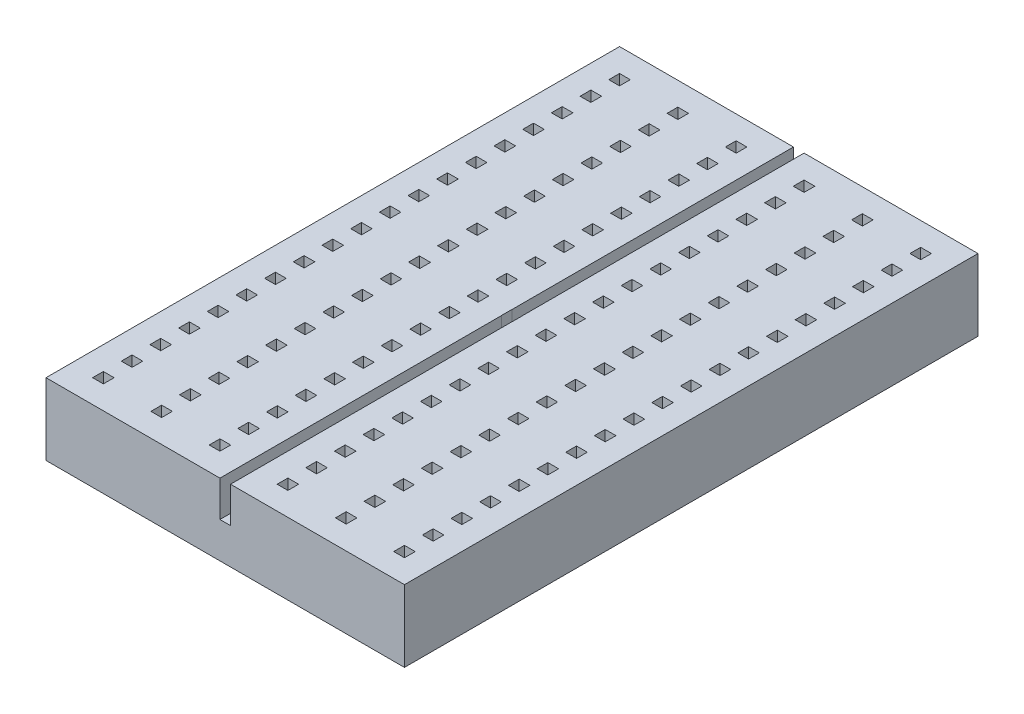
from build123d import *

# Parameters (mm, degrees)
SKETCH1_W           = 50
SKETCH1_H           = 80
BOSS_EXTRUDE1_DEPTH = 10
SKETCH2_W           = 1.477514692
SKETCH2_H           = 80
CUT_EXTRUDE1_DEPTH  = 5
SKETCH4_W           = 1.5
SKETCH4_H           = 1.5
CUT_EXTRUDE2_DEPTH  = 2


with BuildPart() as part:
    # Sketch1 → Boss-Extrude1 (new body)
    with BuildSketch(Plane(origin=(0, 0, 0), x_dir=(1, 0, 0), z_dir=(0, 1, 0))):
        Rectangle(SKETCH1_W, SKETCH1_H)
    extrude(amount=BOSS_EXTRUDE1_DEPTH)

    # Sketch2 → Cut-Extrude1 (cut)
    with BuildSketch(Plane(origin=(0, 10, 0), x_dir=(1, 0, 0), z_dir=(0, 1, 0))):
        Rectangle(SKETCH2_W, SKETCH2_H)
    extrude(amount=-CUT_EXTRUDE1_DEPTH, mode=Mode.SUBTRACT)

    # Sketch4 → Cut-Extrude2 (cut)
    with BuildSketch(Plane(origin=(0, 10, 0), x_dir=(1, 0, 0), z_dir=(0, 1, 0))):
        with Locations((-21, 36)):
            Rectangle(SKETCH4_W, SKETCH4_H)
    cut_extrude2 = extrude(amount=-CUT_EXTRUDE2_DEPTH, mode=Mode.SUBTRACT)

    # Sketch-Pattern1: Cut-Extrude2 at 116 more places
    with Locations((8.13, 0, 0), (16.261243, 0, 0), (0, 0, 4), (8.130621, 0, 4), (8.071746, 0, 36), (16.261243, 0, 4), (0, 0, 8), (8.13, 0, 8), (16.261243, 0, 8), (0, 0, 12), (8.130621, 0, 12), (16.261243, 0, 12), (0, 0, 16), (8.13, 0, 16), (16.261243, 0, 16), (0, 0, 20), (8.130621, 0, 20), (16.261243, 0, 20), (0, 0, 24), (8.13, 0, 24), (16.261243, 0, 24), (0, 0, 28), (8.130621, 0, 28), (16.261243, 0, 28), (0, 0, 32), (8.13, 0, 32), (16.261243, 0, 32), (0, 0, 36), (8.130621, 0, 36), (16.261243, 0, 36), (16.261243, 0, 40), (8.13, 0, 40), (0, 0, 40), (16.261243, 0, 44), (8.130621, 0, 44), (0, 0, 44), (16.261243, 0, 48), (8.13, 0, 48), (0, 0, 48), (16.261243, 0, 52), (8.130621, 0, 52), (0, 0, 52), (16.261243, 0, 56), (8.13, 0, 56), (0, 0, 56), (16.261243, 0, 60), (8.130621, 0, 60), (0, 0, 60), (16.261243, 0, 64), (8.13, 0, 64), (0, 0, 64), (16.261243, 0, 68), (8.130621, 0, 68), (0, 0, 68), (16.261243, 0, 72), (8.13, 0, 72), (0, 0, 72), (21, 0, 36), (42, 0, 72), (33.87, 0, 72), (25.738757, 0, 72), (42, 0, 68), (33.869379, 0, 68), (25.738757, 0, 68), (42, 0, 64), (33.87, 0, 64), (25.738757, 0, 64), (42, 0, 60), (33.869379, 0, 60), (25.738757, 0, 60), (25.738757, 0, 56), (25.738757, 0, 52), (25.738757, 0, 48), (25.738757, 0, 44), (25.738757, 0, 40), (25.738757, 0, 36), (25.738757, 0, 32), (25.738757, 0, 28), (25.738757, 0, 24), (25.738757, 0, 20), (25.738757, 0, 16), (25.738757, 0, 12), (25.738757, 0, 8), (25.738757, 0, 4), (25.738757, 0, 0), (42, 0, 56), (33.87, 0, 56), (42, 0, 52), (33.869379, 0, 52), (42, 0, 48), (33.87, 0, 48), (42, 0, 44), (33.869379, 0, 44), (42, 0, 40), (33.87, 0, 40), (33.869379, 0, 36), (42, 0, 36), (33.87, 0, 32), (42, 0, 32), (33.869379, 0, 28), (42, 0, 28), (33.87, 0, 24), (42, 0, 24), (33.869379, 0, 20), (42, 0, 20), (33.87, 0, 16), (42, 0, 16), (33.869379, 0, 12), (42, 0, 12), (33.87, 0, 8), (42, 0, 8), (33.928254, 0, 36), (33.869379, 0, 4), (42, 0, 4), (33.87, 0, 0), (42, 0, 0)):
        add(cut_extrude2, mode=Mode.SUBTRACT)


solid = part.part
